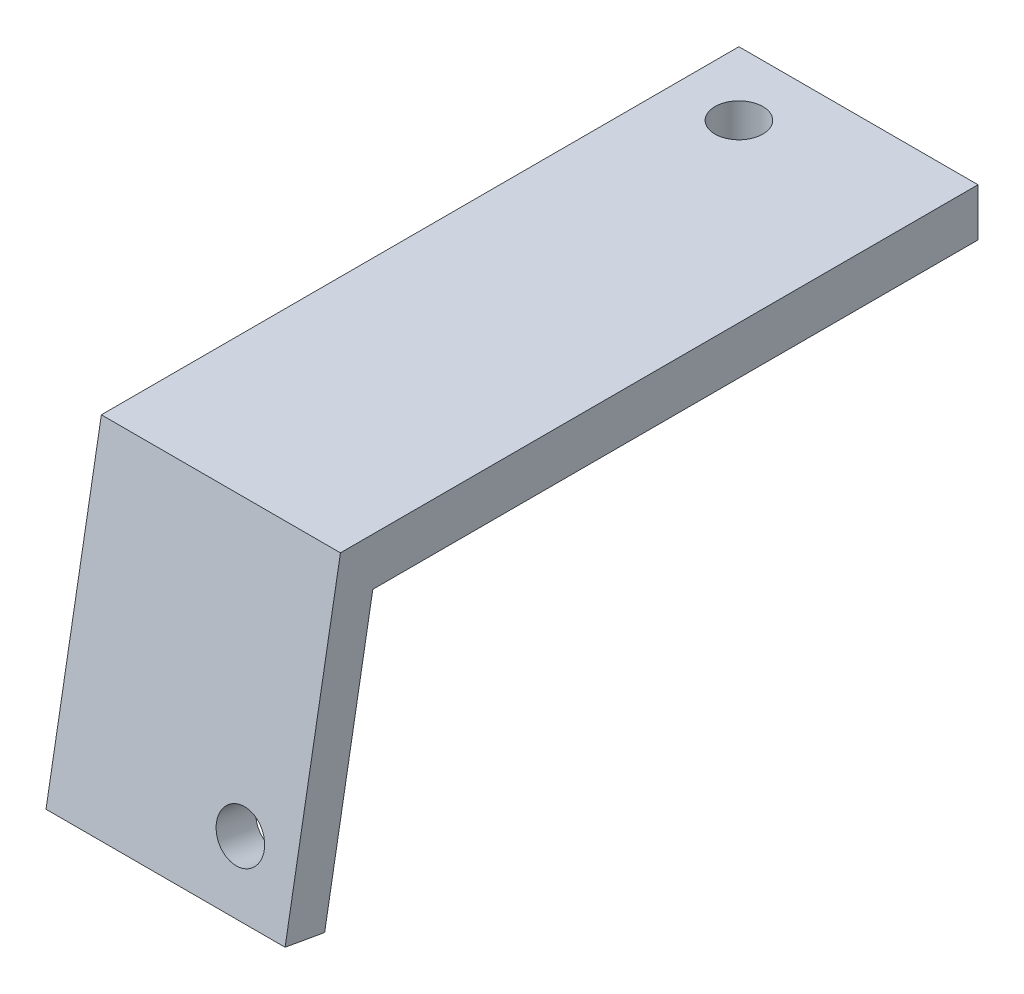
from build123d import *

# Parameters (mm, degrees)
SKETCH1_W           = 15
SKETCH1_H           = 40
SKETCH1_R           = 1.5
BOSS_EXTRUDE1_DEPTH = 3
SKETCH2_W           = 15
SKETCH2_H           = 2.520944533
BOSS_EXTRUDE2_DEPTH = 20
SKETCH3_R           = 1.5
CUT_EXTRUDE1_DEPTH  = 10


with BuildPart() as part:
    # Sketch1 → Boss-Extrude1 (new body)
    with BuildSketch(Plane(origin=(0, 0, 0), x_dir=(1, 0, 0), z_dir=(0, 1, 0))):
        Rectangle(SKETCH1_W, SKETCH1_H)
        with Locations((-3.5, 16)):
            Circle(SKETCH1_R, mode=Mode.SUBTRACT)
    extrude(amount=BOSS_EXTRUDE1_DEPTH)

    # Sketch2 → Boss-Extrude2 (add)
    with BuildSketch(Plane(origin=(0, -0.510662502, 0.090043577), x_dir=(1, 0, 0), z_dir=(0, 0.9848077530122075, -0.17364817766693402))):
        with Locations((0, -18.956627327)):
            Rectangle(SKETCH2_W, SKETCH2_H)
    extrude(amount=-BOSS_EXTRUDE2_DEPTH)

    # Sketch3 → Cut-Extrude1 (cut)
    with BuildSketch(Plane(origin=(0, 3.510662502, 19.909956423), x_dir=(1, 0, 0), z_dir=(0, 0.173648177666934, 0.9848077530122075))):
        with Locations((4, -16.518540294)):
            Circle(SKETCH3_R)
    extrude(amount=-CUT_EXTRUDE1_DEPTH, mode=Mode.SUBTRACT)


solid = part.part
